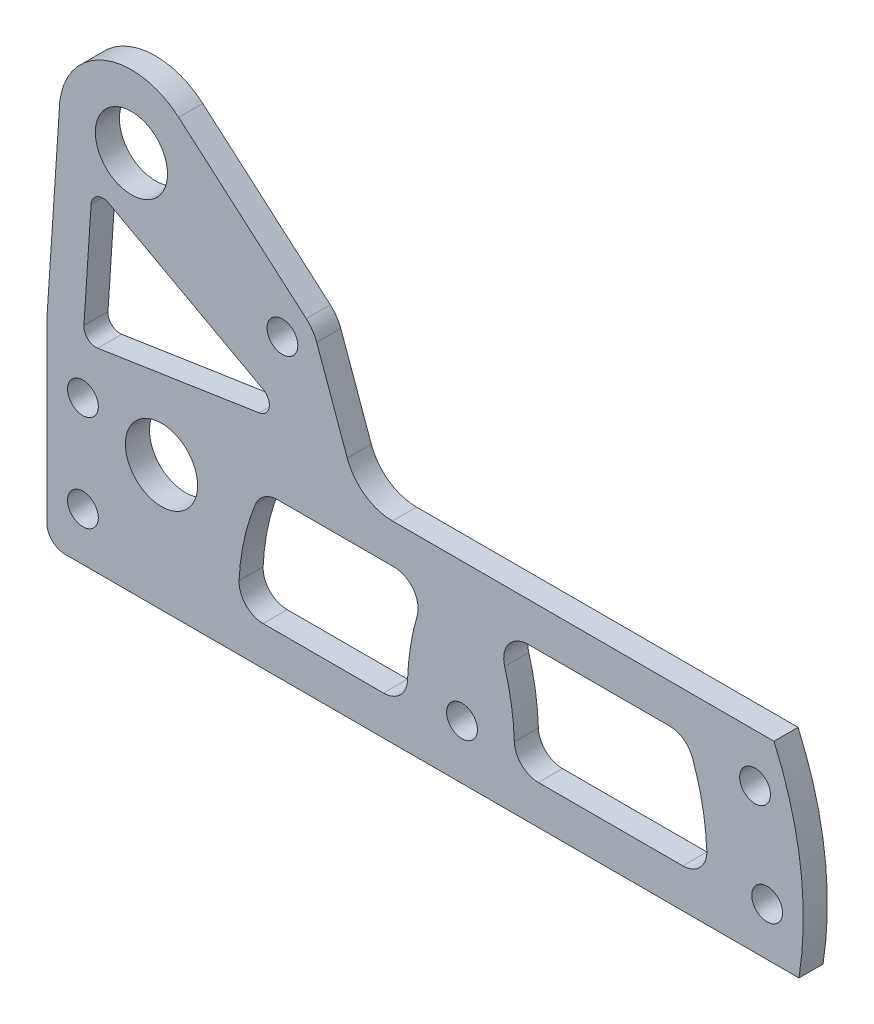
from build123d import *

# Parameters (mm, degrees)
SKETCH1_R           = 2.032
SKETCH1_R_2         = 4.7625
BOSS_EXTRUDE1_DEPTH = 3.175
FILLET1_R           = 6.35
SKETCH2_R           = 2.032
CUT_EXTRUDE1_DEPTH  = 116.854784776
FILLET2_R           = 2.3876
CUT_EXTRUDE2_REACH  = 117.855
FILLET3_R           = 3.175


with BuildPart() as part:
    # Sketch1 → Boss-Extrude1 (new body)
    with BuildSketch(Plane.XY):
        with BuildLine():
            Line((0, 0), (-99.21875, 0))
            Line((-99.21875, 0), (-99.21875, 25.4))
            ThreePointArc((-99.21875, 25.4), (-99.216112514, 25.559225204), (-99.208202949, 25.718275702))
            Line((-99.208202949, 25.718275702), (-97.583411312, 50.206818816))
            ThreePointArc((-97.583411312, 50.206818816), (-92.015151864, 58.871103506), (-81.820717516, 57.405207601))
            Line((-81.820717516, 57.405207601), (-64.992407125, 42.82279889))
            ThreePointArc((-64.992407125, 42.82279889), (-64.174703888, 41.906719209), (-63.615743119, 40.813374148))
            Line((-63.615743119, 40.813374148), (-58.084627995, 25.4))
            Line((-58.084627995, 25.4), (-3.297296565, 25.4))
            ThreePointArc((-3.297296565, 25.4), (0.195780415, 12.939434189), (0, 0))
        make_face()
        with Locations((-44.45, 7.14375)):
            Circle(SKETCH1_R, mode=Mode.SUBTRACT)
        with Locations((-84.089661312, 16.5735)):
            Circle(SKETCH1_R_2, mode=Mode.SUBTRACT)
        with Locations((-88.058411312, 50.206818816)):
            Circle(SKETCH1_R_2, mode=Mode.SUBTRACT)
        with Locations((-4.19910616, 6.35)):
            Circle(SKETCH1_R, mode=Mode.SUBTRACT)
        with Locations((-5.795027999, 19.05)):
            Circle(SKETCH1_R, mode=Mode.SUBTRACT)
        with Locations((-94.45625, 6.35)):
            Circle(SKETCH1_R, mode=Mode.SUBTRACT)
        with Locations((-94.45625, 19.05)):
            Circle(SKETCH1_R, mode=Mode.SUBTRACT)
    extrude(amount=BOSS_EXTRUDE1_DEPTH)

    # Fillet1
    fillet1_edges = [part.edges().sort_by_distance(p)[0] for p in [
        (-58.084627995, 25.4, 1.5875),
    ]]
    fillet(fillet1_edges, radius=FILLET1_R)

    # Sketch2 → Cut-Extrude1 (cut, through all)
    with BuildSketch(Plane.XY.offset(3.175)):
        with Locations((-68.140747312, 39.189568816)):
            Circle(SKETCH2_R)
    extrude(amount=-CUT_EXTRUDE1_DEPTH, mode=Mode.SUBTRACT)

    # Fillet2
    fillet2_edges = [part.edges().sort_by_distance(p)[0] for p in [
        (-99.21875, 0, 1.5875),
    ]]
    fillet(fillet2_edges, radius=FILLET2_R)

    # Sketch4 → Cut-Extrude2 (cut, up to next)
    with BuildSketch(Plane(origin=(0, 0, 0), x_dir=(-1, 0, 0), z_dir=(0, 0, -1)), mode=Mode.PRIVATE) as cut_extrude2_sk1:
        with BuildLine():
            Line((14.906243411, 20.25001426), (40.306243411, 20.25001426))
            ThreePointArc((40.306243411, 20.25001426), (38.03973616, 12.863437985), (37.591162137, 5.14998574))
            Line((37.591162137, 5.14998574), (12.191162137, 5.14998574))
            ThreePointArc((12.191162137, 5.14998574), (12.63973616, 12.863437985), (14.906243411, 20.25001426))
        make_face()
    cut_extrude2_tool1 = extrude(cut_extrude2_sk1.sketch, amount=-CUT_EXTRUDE2_REACH, mode=Mode.PRIVATE) & part.part
    # Sketch4 → Cut-Extrude2 (cut, up to next)
    with BuildSketch(Plane(origin=(0, 0, 0), x_dir=(-1, 0, 0), z_dir=(0, 0, -1)), mode=Mode.PRIVATE) as cut_extrude2_sk2:
        with BuildLine():
            Line((71.210862075, 28.952720027), (92.501475834, 25.698758848))
            ThreePointArc((92.501475834, 25.698758848), (93.814902604, 26.098604816), (94.325334391, 27.37313456))
            Line((94.325334391, 27.37313456), (93.375138804, 41.6942974))
            ThreePointArc((93.375138804, 41.6942974), (92.556554604, 42.979979171), (91.032400998, 42.983652428))
            Line((91.032400998, 42.983652428), (70.691982826, 31.916450766))
            ThreePointArc((70.691982826, 31.916450766), (69.886987798, 30.248228031), (71.210862075, 28.952720027))
        make_face()
    cut_extrude2_tool2 = extrude(cut_extrude2_sk2.sketch, amount=-CUT_EXTRUDE2_REACH, mode=Mode.PRIVATE) & part.part
    # Sketch4 → Cut-Extrude2 (cut, up to next)
    with BuildSketch(Plane(origin=(0, 0, 0), x_dir=(-1, 0, 0), z_dir=(0, 0, -1)), mode=Mode.PRIVATE) as cut_extrude2_sk3:
        with BuildLine():
            Line((73.81875, 5.14998574), (51.59375, 5.14998574))
            ThreePointArc((51.59375, 5.14998574), (51.145175977, 12.863437985), (48.878668725, 20.25001426))
            Line((48.878668725, 20.25001426), (70.807625266, 20.25001426))
            ThreePointArc((70.807625266, 20.25001426), (73.317974303, 12.900366376), (73.81875, 5.14998574))
        make_face()
    cut_extrude2_tool3 = extrude(cut_extrude2_sk3.sketch, amount=-CUT_EXTRUDE2_REACH, mode=Mode.PRIVATE) & part.part
    add(cut_extrude2_tool1.solids().sort_by_distance((-25.621324, 12.7, 0))[0], mode=Mode.SUBTRACT)
    add(cut_extrude2_tool2.solids().sort_by_distance((-84.934877, 33.097306, 0))[0], mode=Mode.SUBTRACT)
    add(cut_extrude2_tool3.solids().sort_by_distance((-61.941303, 12.68386, 0))[0], mode=Mode.SUBTRACT)

    # Fillet3
    fillet3_edges = [part.edges().sort_by_distance(p)[0] for p in [
        (-51.59375, 5.14998574, 1.5875),
        (-73.81875, 5.14998574, 1.5875),
        (-70.807625266, 20.25001426, 1.5875),
        (-48.878668725, 20.25001426, 1.5875),
        (-37.591162137, 5.14998574, 1.5875),
        (-12.191162137, 5.14998574, 1.5875),
        (-14.906243411, 20.25001426, 1.5875),
        (-40.306243411, 20.25001426, 1.5875),
    ]]
    fillet(fillet3_edges, radius=FILLET3_R)


solid = part.part
